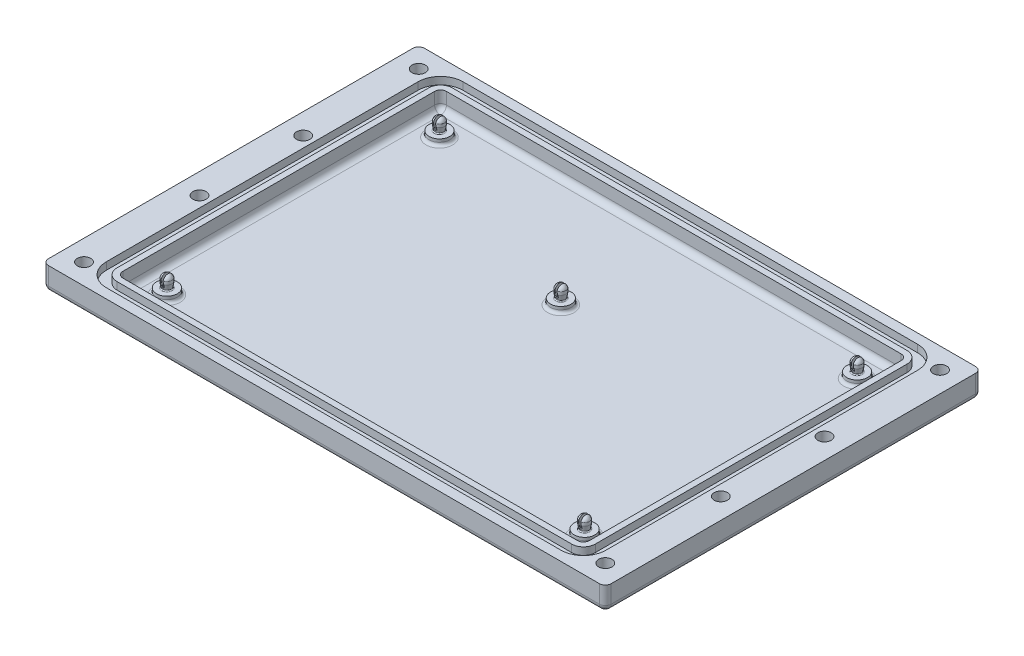
from build123d import *

# Parameters (mm, degrees)
SKETCH1_W                     = 190
SKETCH1_H                     = 127
BOSS_EXTRUDE1_DEPTH           = 8
FILLET1_R                     = 2
SKETCH2_W                     = 157.48
SKETCH2_H                     = 109.22
CUT_EXTRUDE1_DEPTH            = 6
FILLET2_R                     = 2
CUT_EXTRUDE2_DEPTH            = 2.5
SKETCH4_R                     = 3.5
BOSS_EXTRUDE2_DEPTH           = 2
FILLET3_R                     = 1
SKETCH7_R                     = 1.4
BOSS_EXTRUDE3_DEPTH           = 2
BOSS_EXTRUDE3_DRAFT           = -9
BOSS_EXTRUDE3_PROFILE_2_DEPTH = 2
BOSS_EXTRUDE3_PROFILE_2_DRAFT = -9
BOSS_EXTRUDE3_PROFILE_3_DEPTH = 2
BOSS_EXTRUDE3_PROFILE_3_DRAFT = -9
BOSS_EXTRUDE3_PROFILE_4_DEPTH = 2
BOSS_EXTRUDE3_PROFILE_4_DRAFT = -9
BOSS_EXTRUDE3_PROFILE_5_DEPTH = 2
BOSS_EXTRUDE3_PROFILE_5_DRAFT = -9
SKETCH8_R                     = 1.716768881
BOSS_EXTRUDE4_DEPTH           = 1
BOSS_EXTRUDE4_DRAFT           = 3
BOSS_EXTRUDE4_PROFILE_2_DEPTH = 1
BOSS_EXTRUDE4_PROFILE_2_DRAFT = 3
BOSS_EXTRUDE4_PROFILE_3_DEPTH = 1
BOSS_EXTRUDE4_PROFILE_3_DRAFT = 3
BOSS_EXTRUDE4_PROFILE_4_DEPTH = 1
BOSS_EXTRUDE4_PROFILE_4_DRAFT = 3
BOSS_EXTRUDE4_PROFILE_5_DEPTH = 1
BOSS_EXTRUDE4_PROFILE_5_DRAFT = 3
DOME2_FACE_RADIUS             = 1.664361101
DOME2_HEIGHT                  = 1.3
DOME3_FACE_RADIUS             = 1.664361101
DOME3_HEIGHT                  = 1.3
DOME4_FACE_RADIUS             = 1.664361101
DOME4_HEIGHT                  = 1.3
DOME5_FACE_RADIUS             = 1.664361101
DOME5_HEIGHT                  = 1.3
DOME6_FACE_RADIUS             = 1.664361101
DOME6_HEIGHT                  = 1.3
CUT_EXTRUDE3_DEPTH            = 229.676627577
CUT_EXTRUDE3_DEPTH_BACK       = 3
SKETCH9_W                     = 0.7
SKETCH9_H                     = 6
FILLET4_R                     = 0.2
FILLET5_R                     = 0.3
SKETCH10_R                    = 2.25
CUT_EXTRUDE4_DEPTH            = 229.676627577
CUT_EXTRUDE5_DEPTH            = 3.2


with BuildPart() as part:
    # Sketch1 → Boss-Extrude1 (new body)
    with BuildSketch(Plane(origin=(0, 0, 0), x_dir=(1, 0, 0), z_dir=(0, 1, 0))):
        with Locations((95, 63.5)):
            Rectangle(SKETCH1_W, SKETCH1_H)
    extrude(amount=BOSS_EXTRUDE1_DEPTH)

    # Fillet1
    fillet1_edges = [part.edges().sort_by_distance(p)[0] for p in [
        (95, 0, -127),
        (190, 0, -63.5),
        (95, 0, 0),
        (0, 0, -63.5),
        (0, 4, -127),
        (190, 4, -127),
        (190, 4, 0),
        (0, 4, 0),
    ]]
    fillet(fillet1_edges, radius=FILLET1_R)

    # Sketch2 → Cut-Extrude1 (cut)
    with BuildSketch(Plane(origin=(0, 8, 0), x_dir=(1, 0, 0), z_dir=(0, 1, 0))):
        with Locations((95, 63.5)):
            Rectangle(SKETCH2_W, SKETCH2_H)
    extrude(amount=-CUT_EXTRUDE1_DEPTH, mode=Mode.SUBTRACT)

    # Fillet2
    fillet2_edges = [part.edges().sort_by_distance(p)[0] for p in [
        (173.74, 2, -63.5),
        (173.74, 5, -118.11),
        (95, 2, -8.89),
        (173.74, 5, -8.89),
        (16.26, 2, -63.5),
        (16.26, 5, -8.89),
        (95, 2, -118.11),
        (16.26, 5, -118.11),
    ]]
    fillet(fillet2_edges, radius=FILLET2_R)

    # Sketch3 → Cut-Extrude2 (cut)
    with BuildSketch(Plane(origin=(0, 8, 0), x_dir=(1, 0, 0), z_dir=(0, 1, 0))):
        with BuildLine():
            Line((171.74, 123.71), (18.26, 123.71))
            ThreePointArc((18.26, 123.71), (12.885988463, 121.484011537), (10.66, 116.11))
            Line((10.66, 116.11), (10.66, 10.89))
            ThreePointArc((10.66, 10.89), (12.885988463, 5.515988463), (18.26, 3.29))
            Line((18.26, 3.29), (171.74, 3.29))
            ThreePointArc((171.74, 3.29), (177.114011537, 5.515988463), (179.34, 10.89))
            Line((179.34, 10.89), (179.34, 116.11))
            ThreePointArc((179.34, 116.11), (177.114011537, 121.484011537), (171.74, 123.71))
        make_face()
        with BuildLine():
            Line((175.74, 10.89), (175.74, 116.11))
            ThreePointArc((175.74, 116.11), (174.568427125, 118.938427125), (171.74, 120.11))
            Line((171.74, 120.11), (18.26, 120.11))
            ThreePointArc((18.26, 120.11), (15.431572875, 118.938427125), (14.26, 116.11))
            Line((14.26, 116.11), (14.26, 10.89))
            ThreePointArc((14.26, 10.89), (15.431572875, 8.061572875), (18.26, 6.89))
            Line((18.26, 6.89), (171.74, 6.89))
            ThreePointArc((171.74, 6.89), (174.568427125, 8.061572875), (175.74, 10.89))
        make_face(mode=Mode.SUBTRACT)
    extrude(amount=-CUT_EXTRUDE2_DEPTH, mode=Mode.SUBTRACT)

    # Sketch4 → Boss-Extrude2 (add)
    with BuildSketch(Plane(origin=(0, 2, 0), x_dir=(1, 0, 0), z_dir=(0, 1, 0))):
        with Locations(Location((24.5, 109.5, 0), (0, 0, 90))):
            Circle(SKETCH4_R)
        with Locations(Location((94, 81, 0), (0, 0, 90))):
            Circle(SKETCH4_R)
        with Locations(Location((165.5, 109.5, 0), (0, 0, 90))):
            Circle(SKETCH4_R)
        with Locations(Location((165.5, 17.5, 0), (0, 0, 90))):
            Circle(SKETCH4_R)
        with Locations(Location((24.5, 17.5, 0), (0, 0, 90))):
            Circle(SKETCH4_R)
    extrude(amount=BOSS_EXTRUDE2_DEPTH)

    # Fillet3
    fillet3_edges = [part.edges().sort_by_distance(p)[0] for p in [
        (24.5, 2, -106),
        (94, 2, -77.5),
        (165.5, 2, -106),
        (165.5, 2, -14),
        (24.5, 2, -14),
    ]]
    fillet(fillet3_edges, radius=FILLET3_R)


with BuildPart() as boss_extrude3_tool:
    # Sketch7 → Boss-Extrude3 (with draft: the straight prism first)
    with BuildSketch(Plane(origin=(0, 4, 0), x_dir=(1, 0, 0), z_dir=(0, 1, 0))):
        with Locations((24.5, 109.5)):
            Circle(SKETCH7_R)
    extrude(amount=BOSS_EXTRUDE3_DEPTH)
    # Boss-Extrude3: the draft: its side faces are tilted about the plane it starts from
    boss_extrude3_sides = [boss_extrude3_tool.faces().sort_by_distance(p)[0] for p in [
        (23.1, 5, -109.5),
    ]]
    draft(boss_extrude3_sides, Plane(origin=(0, 4, 0), x_dir=(1, 0, 0), z_dir=(0, 1, 0)), BOSS_EXTRUDE3_DRAFT)


with BuildPart() as part_1:
    add(part.part)

    # Boss-Extrude3: add boss_extrude3_tool
    add(boss_extrude3_tool.part)


with BuildPart() as boss_extrude3_profile_2_tool:
    # Sketch7 → Boss-Extrude3 profile 2 (with draft: the straight prism first)
    with BuildSketch(Plane(origin=(0, 4, 0), x_dir=(1, 0, 0), z_dir=(0, 1, 0))):
        with Locations((94, 81)):
            Circle(SKETCH7_R)
    extrude(amount=BOSS_EXTRUDE3_PROFILE_2_DEPTH)
    # Boss-Extrude3 profile 2: the draft: its side faces are tilted about the plane it starts from
    boss_extrude3_profile_2_sides = [boss_extrude3_profile_2_tool.faces().sort_by_distance(p)[0] for p in [
        (92.6, 5, -81),
    ]]
    draft(boss_extrude3_profile_2_sides, Plane(origin=(0, 4, 0), x_dir=(1, 0, 0), z_dir=(0, 1, 0)), BOSS_EXTRUDE3_PROFILE_2_DRAFT)


with BuildPart() as part_2:
    add(part_1.part)

    # Boss-Extrude3 profile 2: add boss_extrude3_profile_2_tool
    add(boss_extrude3_profile_2_tool.part)


with BuildPart() as boss_extrude3_profile_3_tool:
    # Sketch7 → Boss-Extrude3 profile 3 (with draft: the straight prism first)
    with BuildSketch(Plane(origin=(0, 4, 0), x_dir=(1, 0, 0), z_dir=(0, 1, 0))):
        with Locations((165.5, 109.5)):
            Circle(SKETCH7_R)
    extrude(amount=BOSS_EXTRUDE3_PROFILE_3_DEPTH)
    # Boss-Extrude3 profile 3: the draft: its side faces are tilted about the plane it starts from
    boss_extrude3_profile_3_sides = [boss_extrude3_profile_3_tool.faces().sort_by_distance(p)[0] for p in [
        (164.1, 5, -109.5),
    ]]
    draft(boss_extrude3_profile_3_sides, Plane(origin=(0, 4, 0), x_dir=(1, 0, 0), z_dir=(0, 1, 0)), BOSS_EXTRUDE3_PROFILE_3_DRAFT)


with BuildPart() as part_3:
    add(part_2.part)

    # Boss-Extrude3 profile 3: add boss_extrude3_profile_3_tool
    add(boss_extrude3_profile_3_tool.part)


with BuildPart() as boss_extrude3_profile_4_tool:
    # Sketch7 → Boss-Extrude3 profile 4 (with draft: the straight prism first)
    with BuildSketch(Plane(origin=(0, 4, 0), x_dir=(1, 0, 0), z_dir=(0, 1, 0))):
        with Locations((165.5, 17.5)):
            Circle(SKETCH7_R)
    extrude(amount=BOSS_EXTRUDE3_PROFILE_4_DEPTH)
    # Boss-Extrude3 profile 4: the draft: its side faces are tilted about the plane it starts from
    boss_extrude3_profile_4_sides = [boss_extrude3_profile_4_tool.faces().sort_by_distance(p)[0] for p in [
        (164.1, 5, -17.5),
    ]]
    draft(boss_extrude3_profile_4_sides, Plane(origin=(0, 4, 0), x_dir=(1, 0, 0), z_dir=(0, 1, 0)), BOSS_EXTRUDE3_PROFILE_4_DRAFT)


with BuildPart() as part_4:
    add(part_3.part)

    # Boss-Extrude3 profile 4: add boss_extrude3_profile_4_tool
    add(boss_extrude3_profile_4_tool.part)


with BuildPart() as boss_extrude3_profile_5_tool:
    # Sketch7 → Boss-Extrude3 profile 5 (with draft: the straight prism first)
    with BuildSketch(Plane(origin=(0, 4, 0), x_dir=(1, 0, 0), z_dir=(0, 1, 0))):
        with Locations((24.5, 17.5)):
            Circle(SKETCH7_R)
    extrude(amount=BOSS_EXTRUDE3_PROFILE_5_DEPTH)
    # Boss-Extrude3 profile 5: the draft: its side faces are tilted about the plane it starts from
    boss_extrude3_profile_5_sides = [boss_extrude3_profile_5_tool.faces().sort_by_distance(p)[0] for p in [
        (23.1, 5, -17.5),
    ]]
    draft(boss_extrude3_profile_5_sides, Plane(origin=(0, 4, 0), x_dir=(1, 0, 0), z_dir=(0, 1, 0)), BOSS_EXTRUDE3_PROFILE_5_DRAFT)


with BuildPart() as part_5:
    add(part_4.part)

    # Boss-Extrude3 profile 5: add boss_extrude3_profile_5_tool
    add(boss_extrude3_profile_5_tool.part)


with BuildPart() as boss_extrude4_tool:
    # Sketch8 → Boss-Extrude4 (with draft: the straight prism first)
    with BuildSketch(Plane(origin=(0, 6, 0), x_dir=(1, 0, 0), z_dir=(0, 1, 0))):
        with Locations((165.5, 109.5)):
            Circle(SKETCH8_R)
    extrude(amount=BOSS_EXTRUDE4_DEPTH)
    # Boss-Extrude4: the draft: its side faces are tilted about the plane it starts from
    boss_extrude4_sides = [boss_extrude4_tool.faces().sort_by_distance(p)[0] for p in [
        (163.783231119, 6.5, -109.5),
    ]]
    draft(boss_extrude4_sides, Plane(origin=(0, 6, 0), x_dir=(1, 0, 0), z_dir=(0, 1, 0)), BOSS_EXTRUDE4_DRAFT)


with BuildPart() as part_6:
    add(part_5.part)

    # Boss-Extrude4: add boss_extrude4_tool
    add(boss_extrude4_tool.part)


with BuildPart() as boss_extrude4_profile_2_tool:
    # Sketch8 → Boss-Extrude4 profile 2 (with draft: the straight prism first)
    with BuildSketch(Plane(origin=(0, 6, 0), x_dir=(1, 0, 0), z_dir=(0, 1, 0))):
        with Locations((94, 81)):
            Circle(SKETCH8_R)
    extrude(amount=BOSS_EXTRUDE4_PROFILE_2_DEPTH)
    # Boss-Extrude4 profile 2: the draft: its side faces are tilted about the plane it starts from
    boss_extrude4_profile_2_sides = [boss_extrude4_profile_2_tool.faces().sort_by_distance(p)[0] for p in [
        (92.283231119, 6.5, -81),
    ]]
    draft(boss_extrude4_profile_2_sides, Plane(origin=(0, 6, 0), x_dir=(1, 0, 0), z_dir=(0, 1, 0)), BOSS_EXTRUDE4_PROFILE_2_DRAFT)


with BuildPart() as part_7:
    add(part_6.part)

    # Boss-Extrude4 profile 2: add boss_extrude4_profile_2_tool
    add(boss_extrude4_profile_2_tool.part)


with BuildPart() as boss_extrude4_profile_3_tool:
    # Sketch8 → Boss-Extrude4 profile 3 (with draft: the straight prism first)
    with BuildSketch(Plane(origin=(0, 6, 0), x_dir=(1, 0, 0), z_dir=(0, 1, 0))):
        with Locations((24.5, 109.5)):
            Circle(SKETCH8_R)
    extrude(amount=BOSS_EXTRUDE4_PROFILE_3_DEPTH)
    # Boss-Extrude4 profile 3: the draft: its side faces are tilted about the plane it starts from
    boss_extrude4_profile_3_sides = [boss_extrude4_profile_3_tool.faces().sort_by_distance(p)[0] for p in [
        (22.783231119, 6.5, -109.5),
    ]]
    draft(boss_extrude4_profile_3_sides, Plane(origin=(0, 6, 0), x_dir=(1, 0, 0), z_dir=(0, 1, 0)), BOSS_EXTRUDE4_PROFILE_3_DRAFT)


with BuildPart() as part_8:
    add(part_7.part)

    # Boss-Extrude4 profile 3: add boss_extrude4_profile_3_tool
    add(boss_extrude4_profile_3_tool.part)


with BuildPart() as boss_extrude4_profile_4_tool:
    # Sketch8 → Boss-Extrude4 profile 4 (with draft: the straight prism first)
    with BuildSketch(Plane(origin=(0, 6, 0), x_dir=(1, 0, 0), z_dir=(0, 1, 0))):
        with Locations((24.5, 17.5)):
            Circle(SKETCH8_R)
    extrude(amount=BOSS_EXTRUDE4_PROFILE_4_DEPTH)
    # Boss-Extrude4 profile 4: the draft: its side faces are tilted about the plane it starts from
    boss_extrude4_profile_4_sides = [boss_extrude4_profile_4_tool.faces().sort_by_distance(p)[0] for p in [
        (22.783231119, 6.5, -17.5),
    ]]
    draft(boss_extrude4_profile_4_sides, Plane(origin=(0, 6, 0), x_dir=(1, 0, 0), z_dir=(0, 1, 0)), BOSS_EXTRUDE4_PROFILE_4_DRAFT)


with BuildPart() as part_9:
    add(part_8.part)

    # Boss-Extrude4 profile 4: add boss_extrude4_profile_4_tool
    add(boss_extrude4_profile_4_tool.part)


with BuildPart() as boss_extrude4_profile_5_tool:
    # Sketch8 → Boss-Extrude4 profile 5 (with draft: the straight prism first)
    with BuildSketch(Plane(origin=(0, 6, 0), x_dir=(1, 0, 0), z_dir=(0, 1, 0))):
        with Locations((165.5, 17.5)):
            Circle(SKETCH8_R)
    extrude(amount=BOSS_EXTRUDE4_PROFILE_5_DEPTH)
    # Boss-Extrude4 profile 5: the draft: its side faces are tilted about the plane it starts from
    boss_extrude4_profile_5_sides = [boss_extrude4_profile_5_tool.faces().sort_by_distance(p)[0] for p in [
        (163.783231119, 6.5, -17.5),
    ]]
    draft(boss_extrude4_profile_5_sides, Plane(origin=(0, 6, 0), x_dir=(1, 0, 0), z_dir=(0, 1, 0)), BOSS_EXTRUDE4_PROFILE_5_DRAFT)


with BuildPart() as part_10:
    add(part_9.part)

    # Boss-Extrude4 profile 5: add boss_extrude4_profile_5_tool
    add(boss_extrude4_profile_5_tool.part)

    # Dome2: a dome of height H over a round flat face of radius A is a cap of a sphere of radius (A * A + H * H) / (2 * H)
    dome2_r = (DOME2_FACE_RADIUS * DOME2_FACE_RADIUS + DOME2_HEIGHT * DOME2_HEIGHT) / (2 * DOME2_HEIGHT)
    dome2_base = Plane((165.5, 7, -17.5), z_dir=(0, 1, 0))
    with Locations(dome2_base.offset(DOME2_HEIGHT - dome2_r)):
        dome2_ball = Sphere(dome2_r, mode=Mode.PRIVATE)
    add(split(dome2_ball, bisect_by=dome2_base, keep=Keep.TOP, mode=Mode.PRIVATE))

    # Dome3: a dome of height H over a round flat face of radius A is a cap of a sphere of radius (A * A + H * H) / (2 * H)
    dome3_r = (DOME3_FACE_RADIUS * DOME3_FACE_RADIUS + DOME3_HEIGHT * DOME3_HEIGHT) / (2 * DOME3_HEIGHT)
    dome3_base = Plane((165.5, 7, -109.5), z_dir=(0, 1, 0))
    with Locations(dome3_base.offset(DOME3_HEIGHT - dome3_r)):
        dome3_ball = Sphere(dome3_r, mode=Mode.PRIVATE)
    add(split(dome3_ball, bisect_by=dome3_base, keep=Keep.TOP, mode=Mode.PRIVATE))

    # Dome4: a dome of height H over a round flat face of radius A is a cap of a sphere of radius (A * A + H * H) / (2 * H)
    dome4_r = (DOME4_FACE_RADIUS * DOME4_FACE_RADIUS + DOME4_HEIGHT * DOME4_HEIGHT) / (2 * DOME4_HEIGHT)
    dome4_base = Plane((94, 7, -81), z_dir=(0, 1, 0))
    with Locations(dome4_base.offset(DOME4_HEIGHT - dome4_r)):
        dome4_ball = Sphere(dome4_r, mode=Mode.PRIVATE)
    add(split(dome4_ball, bisect_by=dome4_base, keep=Keep.TOP, mode=Mode.PRIVATE))

    # Dome5: a dome of height H over a round flat face of radius A is a cap of a sphere of radius (A * A + H * H) / (2 * H)
    dome5_r = (DOME5_FACE_RADIUS * DOME5_FACE_RADIUS + DOME5_HEIGHT * DOME5_HEIGHT) / (2 * DOME5_HEIGHT)
    dome5_base = Plane((24.5, 7, -17.5), z_dir=(0, 1, 0))
    with Locations(dome5_base.offset(DOME5_HEIGHT - dome5_r)):
        dome5_ball = Sphere(dome5_r, mode=Mode.PRIVATE)
    add(split(dome5_ball, bisect_by=dome5_base, keep=Keep.TOP, mode=Mode.PRIVATE))

    # Dome6: a dome of height H over a round flat face of radius A is a cap of a sphere of radius (A * A + H * H) / (2 * H)
    dome6_r = (DOME6_FACE_RADIUS * DOME6_FACE_RADIUS + DOME6_HEIGHT * DOME6_HEIGHT) / (2 * DOME6_HEIGHT)
    dome6_base = Plane((24.5, 7, -109.5), z_dir=(0, 1, 0))
    with Locations(dome6_base.offset(DOME6_HEIGHT - dome6_r)):
        dome6_ball = Sphere(dome6_r, mode=Mode.PRIVATE)
    add(split(dome6_ball, bisect_by=dome6_base, keep=Keep.TOP, mode=Mode.PRIVATE))

    # Sketch9 → Cut-Extrude3 (cut, two sides: drawn at the far end of the back side and taken through both)
    with BuildSketch(Plane(origin=(0, 8, 0), x_dir=(1, 0, 0), z_dir=(0, 1, 0)).offset(-CUT_EXTRUDE3_DEPTH_BACK)):
        with Locations((165.5, 17.5)):
            Rectangle(SKETCH9_W, SKETCH9_H)
        with Locations((165.5, 109.5)):
            Rectangle(SKETCH9_W, SKETCH9_H)
        with Locations((94, 81)):
            Rectangle(SKETCH9_W, SKETCH9_H)
        with Locations((24.5, 109.5)):
            Rectangle(SKETCH9_W, SKETCH9_H)
        with Locations((24.5, 17.5)):
            Rectangle(SKETCH9_W, SKETCH9_H)
    extrude(amount=CUT_EXTRUDE3_DEPTH + CUT_EXTRUDE3_DEPTH_BACK, mode=Mode.SUBTRACT)

    # Fillet4
    fillet4_edges = [part_10.edges().sort_by_distance(p)[0] for p in [
        (165.85, 5, -17.5),
        (165.15, 5, -17.5),
        (165.85, 5, -109.5),
        (165.15, 5, -109.5),
        (94.35, 5, -81),
        (93.65, 5, -81),
        (24.85, 5, -17.5),
        (24.15, 5, -17.5),
        (24.85, 5, -109.5),
        (24.15, 5, -109.5),
    ]]
    fillet(fillet4_edges, radius=FILLET4_R)
    fillet4_2_edges = [part_10.edges().sort_by_distance(p)[0] for p in [
        (165.85, 5.591973447, -19.114645228),
        (165.85, 5.591973447, -15.885354772),
        (165.15, 5.591973447, -19.114645228),
        (165.15, 5.591973447, -15.885354772),
        (165.85, 5.591973447, -111.114645228),
        (165.85, 5.591973447, -107.885354772),
        (165.15, 5.591973447, -111.114645228),
        (165.15, 5.591973447, -107.885354772),
        (94.35, 5.591973447, -82.614645228),
        (94.35, 5.591973447, -79.385354772),
        (93.65, 5.591973447, -82.614645228),
        (93.65, 5.591973447, -79.385354772),
        (24.85, 5.591973447, -19.114645228),
        (24.85, 5.591973447, -15.885354772),
        (24.15, 5.591973447, -19.114645228),
        (24.15, 5.591973447, -15.885354772),
        (24.85, 5.591973447, -111.114645228),
        (24.85, 5.591973447, -107.885354772),
        (24.15, 5.591973447, -111.114645228),
        (24.15, 5.591973447, -107.885354772),
        (165.5, 5, -19.05838444),
        (165.5, 5, -15.94161556),
        (165.5, 5, -111.05838444),
        (165.5, 5, -107.94161556),
        (94, 5, -82.55838444),
        (94, 5, -79.44161556),
        (24.5, 5, -19.05838444),
        (24.5, 5, -15.94161556),
        (24.5, 5, -111.05838444),
        (24.5, 5, -107.94161556),
        (24.791826854, 5.058985308, -107.959673934),
        (24.2081735, 5.058984952, -107.959673923),
        (24.2081735, 5.058984952, -111.040326077),
        (24.791826854, 5.058985308, -111.040326066),
        (24.791826854, 5.058985308, -15.959673934),
        (24.2081735, 5.058984952, -15.959673923),
        (24.2081735, 5.058984952, -19.040326077),
        (24.791826854, 5.058985308, -19.040326066),
        (94.291826854, 5.058985308, -79.459673934),
        (93.7081735, 5.058984952, -79.459673923),
        (93.7081735, 5.058984952, -82.540326077),
        (94.291826854, 5.058985308, -82.540326066),
        (165.791826854, 5.058985308, -107.959673934),
        (165.2081735, 5.058984952, -107.959673923),
        (165.2081735, 5.058984952, -111.040326077),
        (165.791826854, 5.058985308, -111.040326066),
        (165.791826854, 5.058985308, -15.959673934),
        (165.2081735, 5.058984952, -15.959673923),
        (165.2081735, 5.058984952, -19.040326077),
        (165.791826854, 5.058985308, -19.040326066),
    ]]
    fillet(fillet4_2_edges, radius=FILLET4_R)

    # Fillet5
    fillet5_edges = [part_10.edges().sort_by_distance(p)[0] for p in [
        (23.1, 4, -109.5),
        (92.6, 4, -81),
        (164.1, 4, -109.5),
        (164.1, 4, -17.5),
        (23.1, 4, -17.5),
    ]]
    fillet(fillet5_edges, radius=FILLET5_R)

    # Sketch10 → Cut-Extrude4 (cut, through all)
    with BuildSketch(Plane(origin=(0, 8, 0), x_dir=(1, 0, 0), z_dir=(0, 1, 0))):
        with Locations(Location((7, 120, 0), (0, 0, 270))):
            Circle(SKETCH10_R)
        with Locations(Location((7, 81, 0), (0, 0, 270))):
            Circle(SKETCH10_R)
        with Locations(Location((7, 46, 0), (0, 0, 270))):
            Circle(SKETCH10_R)
        with Locations(Location((7, 7, 0), (0, 0, 270))):
            Circle(SKETCH10_R)
        with Locations(Location((183, 7, 0), (0, 0, 270))):
            Circle(SKETCH10_R)
        with Locations(Location((183, 46, 0), (0, 0, 270))):
            Circle(SKETCH10_R)
        with Locations(Location((183, 81, 0), (0, 0, 270))):
            Circle(SKETCH10_R)
        with Locations(Location((183, 120, 0), (0, 0, 270))):
            Circle(SKETCH10_R)
    extrude(amount=-CUT_EXTRUDE4_DEPTH, mode=Mode.SUBTRACT)

    # Sketch11 → Cut-Extrude5 (cut)
    with BuildSketch(Plane.XZ):
        Polygon((186.5, -9.020725942), (186.5, -4.979274058), (183, -2.958548116), (179.5, -4.979274058), (179.5, -9.020725942), (183, -11.041451884), align=None)
        Polygon((186.5, -48.020725942), (186.5, -43.979274058), (183, -41.958548116), (179.5, -43.979274058), (179.5, -48.020725942), (183, -50.041451884), align=None)
        Polygon((186.5, -78.979274058), (183, -76.958548116), (179.5, -78.979274058), (179.5, -83.020725942), (183, -85.041451884), (186.5, -83.020725942), align=None)
        Polygon((186.5, -117.979274058), (183, -115.958548116), (179.5, -117.979274058), (179.5, -122.020725942), (183, -124.041451884), (186.5, -122.020725942), align=None)
        Polygon((3.5, -117.979274058), (3.5, -122.020725942), (7, -124.041451884), (10.5, -122.020725942), (10.5, -117.979274058), (7, -115.958548116), align=None)
        Polygon((3.5, -78.979274058), (3.5, -83.020725942), (7, -85.041451884), (10.5, -83.020725942), (10.5, -78.979274058), (7, -76.958548116), align=None)
        Polygon((3.5, -43.979274058), (3.5, -48.020725942), (7, -50.041451884), (10.5, -48.020725942), (10.5, -43.979274058), (7, -41.958548116), align=None)
        Polygon((3.5, -4.979274058), (3.5, -9.020725942), (7, -11.041451884), (10.5, -9.020725942), (10.5, -4.979274058), (7, -2.958548116), align=None)
    extrude(amount=-CUT_EXTRUDE5_DEPTH, mode=Mode.SUBTRACT)


solid = part_10.part
